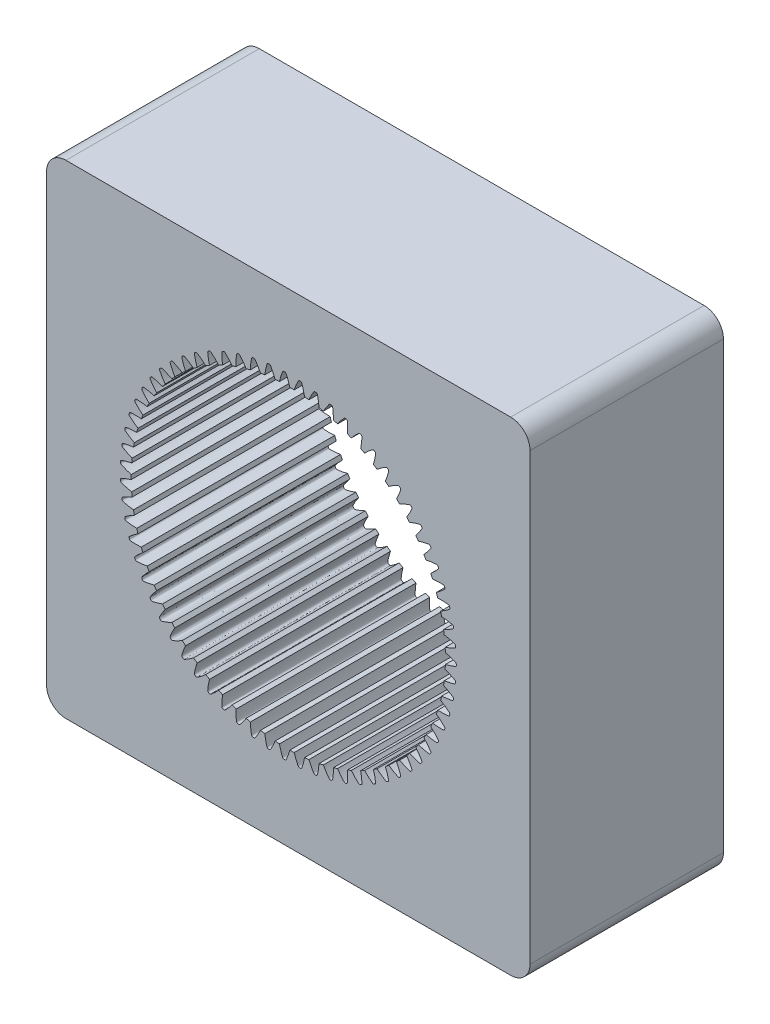
from build123d import *

# Parameters (mm, degrees)
SKETCHREVOLVERING_GEAR_FIXED01_W       = 20
SKETCHREVOLVERING_GEAR_FIXED01_H       = 53.750000244
TOOTHEXTRUDECUTRING_GEAR_FIXED01_START = -2.5
TOOTHEXTRUDECUTRING_GEAR_FIXED01_DEPTH = 20
PATTERNRING_GEAR_FIXED01_COUNT         = 67
SKETCH_4_OUTSIDE_W                     = 181.8
SKETCH_4_OUTSIDE_H                     = 181.8
SKETCH_4_OUTSIDE_W_2                   = 50
SKETCH_4_OUTSIDE_H_2                   = 50
CUT_EXTRUDE_2_DEPTH                    = 20
FILLET_1_R                             = 2


with BuildPart() as part:
    # SketchRevolveRing_Gear_Fixed01 → Ring_Gear_Fixed01 (revolve)
    with BuildSketch(Plane(origin=(0, 0, 0), x_dir=(0, 0, -1), z_dir=(1, 0, 0))):
        with Locations((-7.5, 43.124999878)):
            Rectangle(SKETCHREVOLVERING_GEAR_FIXED01_W, SKETCHREVOLVERING_GEAR_FIXED01_H)
    revolve(axis=Axis((0, 0, 0), (0, 0, -1)))

    # SketchToothRing_Gear_Fixed01 → ToothExtrudeCutRing_Gear_Fixed01 (cut)
    with BuildSketch(Plane.XY.offset(TOOTHEXTRUDECUTRING_GEAR_FIXED01_START)):
        with BuildLine():
            ThreePointArc((16.14477209, -0.555073436), (16.154311262, 0), (16.14477209, 0.555073436))
            add(Edge.make_bspline(
                [(16.14477209, 0.555073436), (16.202967794, 0.54371621), (16.293669412, 0.523736765), (16.41873063, 0.491956899), (16.52329494, 0.462894707), (16.634675859, 0.429230436), (16.752759715, 0.390720315), (16.877204349, 0.346746743), (17.008545717, 0.298243964), (17.150500104, 0.236932119), (17.262882982, 0.201813833), (17.322985456, 0.158804331), (17.338316886, 0.143476188), (17.351374222, 0.126193975), (17.361766532, 0.107186957), (17.371882904, 0.080431187), (17.375436511, 0.051482037), (17.374885927, 0.022448095), (17.375056645, 0), (17.374885927, -0.022448095), (17.375436511, -0.051482037), (17.371882904, -0.080431187), (17.361766532, -0.107186957), (17.351374222, -0.126193975), (17.338316886, -0.143476188), (17.322985456, -0.158804331), (17.262882982, -0.201813833), (17.150500104, -0.236932119), (17.008545717, -0.298243964), (16.877204349, -0.346746743), (16.752759715, -0.390720315), (16.634675859, -0.429230436), (16.52329494, -0.462894707), (16.41873063, -0.491956899), (16.293669412, -0.523736765), (16.202967794, -0.54371621), (16.14477209, -0.555073436)],
                knots=[0, 0, 0, 0, 0.062626979, 0.098077073, 0.136284901, 0.177250466, 0.220973766, 0.267454802, 0.316693573, 0.36869008, 0.431292976, 0.438894738, 0.4464965, 0.454098262, 0.461700024, 0.469301786, 0.484195783, 0.492097898, 0.5, 0.507902102, 0.515804217, 0.530698214, 0.538299976, 0.545901738, 0.5535035, 0.561105262, 0.568707024, 0.63130992, 0.683306427, 0.732545198, 0.779026234, 0.822749534, 0.863715099, 0.901922927, 0.937373021, 1, 1, 1, 1], degree=3))
        make_face()
    toothextrudecutring_gear_fixed01 = extrude(amount=TOOTHEXTRUDECUTRING_GEAR_FIXED01_DEPTH, mode=Mode.SUBTRACT)

    # PatternRing_Gear_Fixed01: ToothExtrudeCutRing_Gear_Fixed01 ×67 about axis
    patternring_gear_fixed01_axis = Axis((0, 0, 50), (0, 0, -1))
    for i in range(1, PATTERNRING_GEAR_FIXED01_COUNT):
        add(toothextrudecutring_gear_fixed01.rotate(patternring_gear_fixed01_axis, i * 360 / PATTERNRING_GEAR_FIXED01_COUNT), mode=Mode.SUBTRACT)

    # Эскиз4 outside → Вырез-Вытянуть2 (cut)
    with BuildSketch(Plane.XY.offset(17.5)):
        Rectangle(SKETCH_4_OUTSIDE_W, SKETCH_4_OUTSIDE_H)
        Rectangle(SKETCH_4_OUTSIDE_W_2, SKETCH_4_OUTSIDE_H_2, mode=Mode.SUBTRACT)
    extrude(amount=-CUT_EXTRUDE_2_DEPTH, mode=Mode.SUBTRACT)

    # Скругление1
    fillet_1_edges = [part.edges().sort_by_distance(p)[0] for p in [
        (-25, 25, 7.5),
        (-25, -25, 7.5),
        (25, -25, 7.5),
        (25, 25, 7.5),
    ]]
    fillet(fillet_1_edges, radius=FILLET_1_R)


solid = part.part
